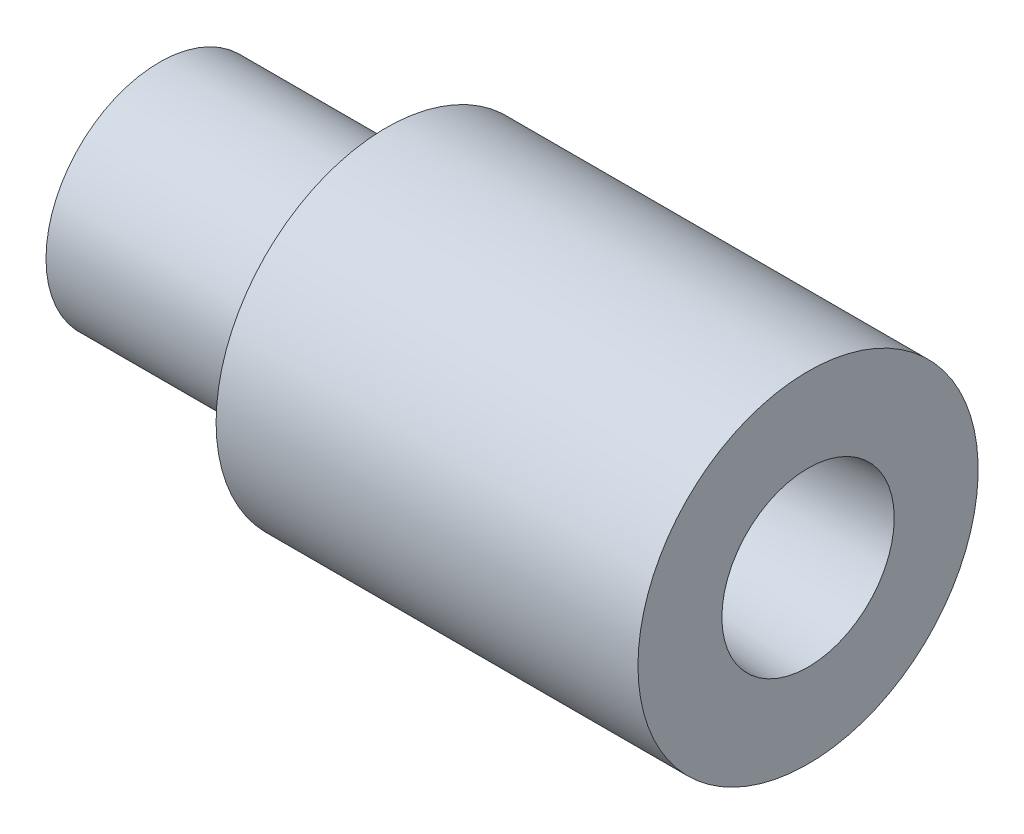
from build123d import *


with BuildPart() as part:
    # Sketch1 → Revolve1 (revolve)
    with BuildSketch(Plane(origin=(0, 0, 0), x_dir=(1, 0, 0), z_dir=(0, 1, 0))):
        Polygon((0, 2.286), (0, 6.35), (12.7, 6.35), (12.7, 9.525), (36.323692292, 9.525), (36.323692292, 4.826), align=None)
    revolve(axis=Axis((0, 0, 0), (1, 0, 0)))


solid = part.part
